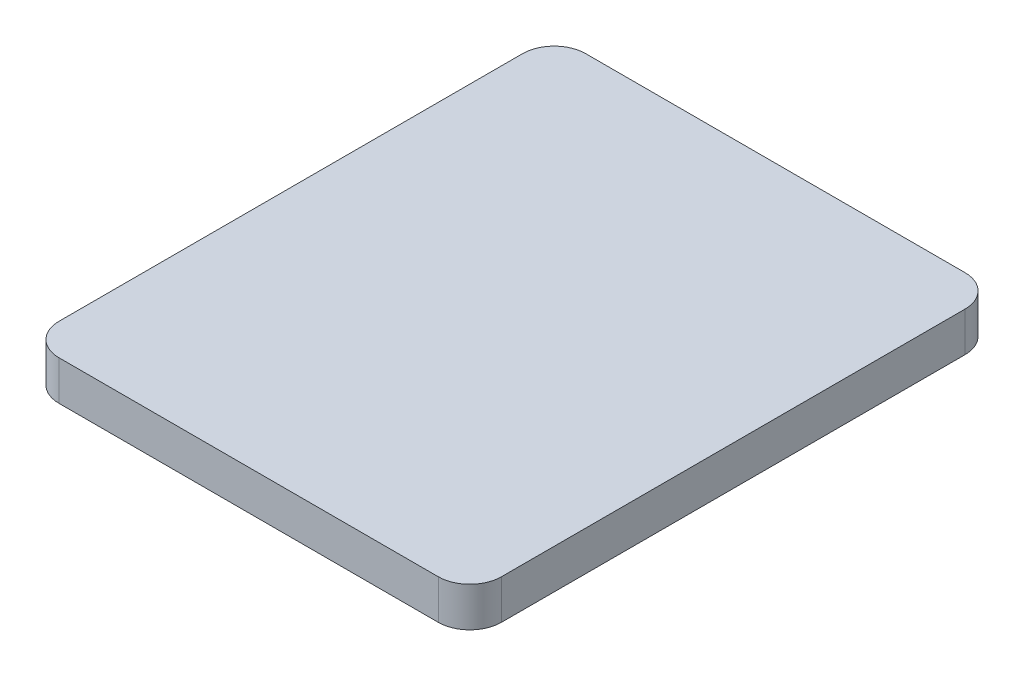
from build123d import *

# Parameters (mm, degrees)
SKETCH1_W           = 42
SKETCH1_H           = 50
BOSS_EXTRUDE1_DEPTH = 3.75
FILLET1_R           = 3


with BuildPart() as part:
    # Sketch1 → Boss-Extrude1 (new body)
    with BuildSketch(Plane(origin=(0, 0, 0), x_dir=(1, 0, 0), z_dir=(0, 1, 0))):
        with Locations((21, 25)):
            Rectangle(SKETCH1_W, SKETCH1_H)
    extrude(amount=BOSS_EXTRUDE1_DEPTH)

    # Fillet1
    fillet1_edges = [part.edges().sort_by_distance(p)[0] for p in [
        (0, 1.875, -50),
        (42, 1.875, -50),
        (0, 1.875, 0),
        (42, 1.875, 0),
    ]]
    fillet(fillet1_edges, radius=FILLET1_R)


solid = part.part
